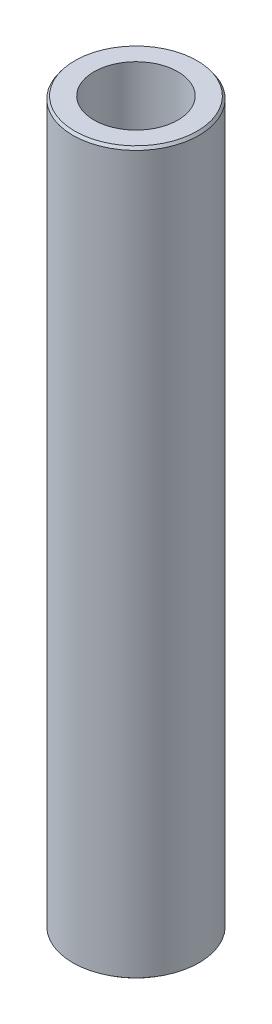
from build123d import *
from OCP.BRepFilletAPI import BRepFilletAPI_MakeChamfer

# Parameters (mm, degrees)
SKETCH1_R           = 52.5
BOSS_EXTRUDE1_DEPTH = 600
SKETCH2_R           = 34.887265925
CUT_EXTRUDE1_DEPTH  = 605.576297914
CHAMFER1_SIZE       = 2.180208679
CHAMFER1_SIZE2      = 1.639985768


with BuildPart() as part:
    # Sketch1 → Boss-Extrude1 (new body)
    with BuildSketch(Plane(origin=(0, 0, 0), x_dir=(1, 0, 0), z_dir=(0, 1, 0))):
        Circle(SKETCH1_R)
    extrude(amount=BOSS_EXTRUDE1_DEPTH)

    # Sketch2 → Cut-Extrude1 (cut, through all)
    with BuildSketch(Plane(origin=(0, 0, 0), x_dir=(1, 0, 0), z_dir=(0, 1, 0))):
        Circle(SKETCH2_R)
    extrude(amount=CUT_EXTRUDE1_DEPTH, mode=Mode.SUBTRACT)

    # Chamfer1: one chamfer whose edges measure the first distance from different faces: ONE call of the kernel's chamfer builder (chamfer() names one face for all edges)
    chamfer1_edges_1 = [part.edges().sort_by_distance(p)[0] for p in [
        (-52.5, 600, 0),
    ]]
    chamfer1_side_1 = [part.faces().sort_by_distance(p)[0] for p in [
        (-52.5, 300, 0),
    ]]
    chamfer1_edges_2 = [part.edges().sort_by_distance(p)[0] for p in [
        (-52.5, 0, 0),
    ]]
    chamfer1_side_2 = [part.faces().sort_by_distance(p)[0] for p in [
        (-51.01507576, 0, 0),
    ]]
    chamfer1 = BRepFilletAPI_MakeChamfer(part.part.solid().wrapped)
    for e in chamfer1_edges_1:
        chamfer1.Add(CHAMFER1_SIZE, CHAMFER1_SIZE2, e.wrapped, chamfer1_side_1[0].wrapped)  # the first distance lies on this face
    for e in chamfer1_edges_2:
        chamfer1.Add(CHAMFER1_SIZE, CHAMFER1_SIZE2, e.wrapped, chamfer1_side_2[0].wrapped)  # the first distance lies on this face
    add(Compound.cast(chamfer1.Shape()), mode=Mode.REPLACE)


solid = part.part
